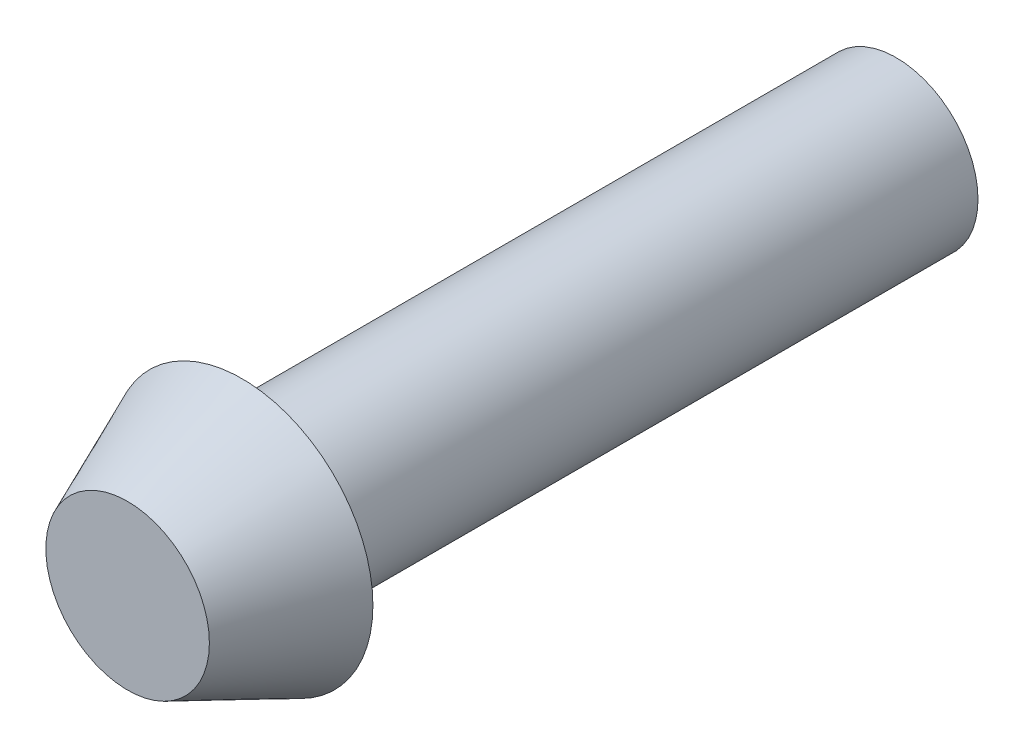
from build123d import *


with BuildPart() as part:
    # BaseBodySke → BaseBody (revolve)
    with BuildSketch(Plane(origin=(0, 0, 0), x_dir=(1, 0, 0), z_dir=(0, 1, 0))):
        Polygon((-5.08, 4.445), (-3.175, 4.445), (-3.175, 29.845), (0, 29.845), (0, 0), (-3.175, 0), align=None)
    revolve(axis=Axis((0, 0, 0), (0, 0, -1)))


solid = part.part
